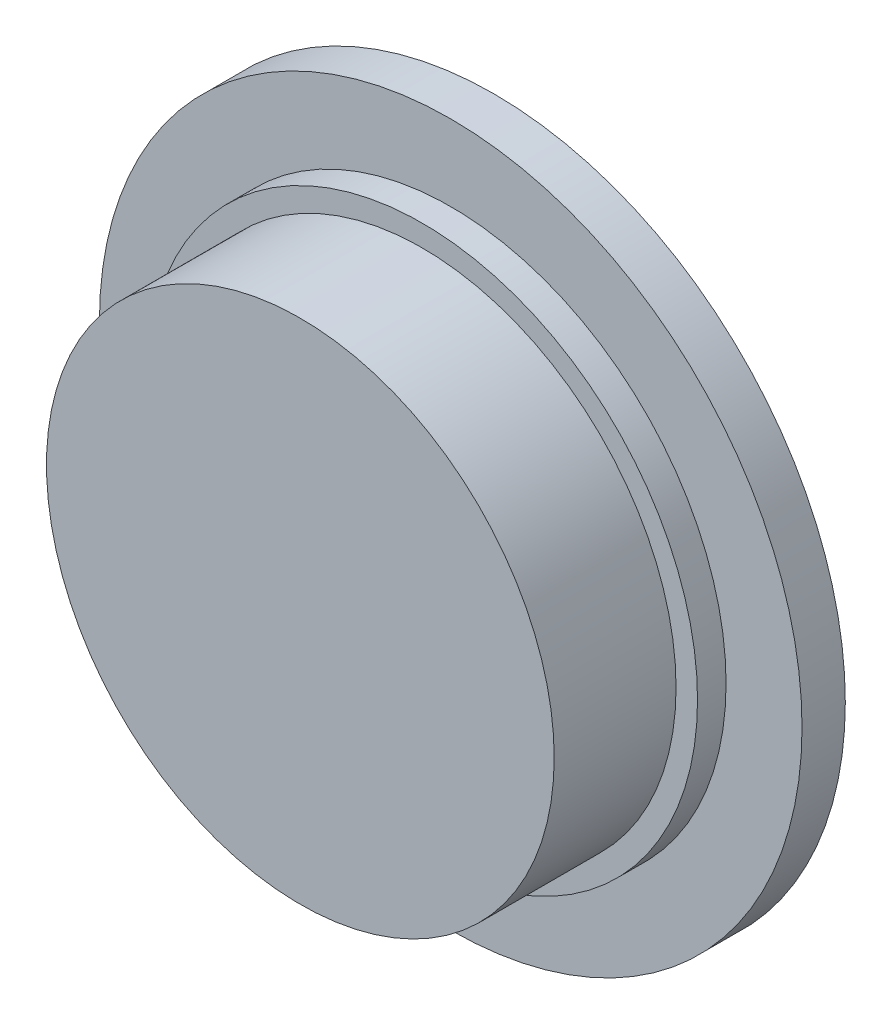
from build123d import *

# Parameters (mm, degrees)
SKETCH6_R          = 6.864817117
CUT_EXTRUDE2_DEPTH = 3.3
SKETCH5_R          = 15.702559167
CUT_EXTRUDE3_DEPTH = 40


with BuildPart() as part:
    # Sketch1 → Revolve2 (revolve)
    with BuildSketch(Plane(origin=(0, 0, 0), x_dir=(0, 0, -1), z_dir=(1, 0, 0))):
        with BuildLine():
            Line((1.771e-06, 9.5), (1.771e-06, 7.445611339))
            Line((1.771e-06, 7.445611339), (-0.771464581, 7.445611339))
            Line((-0.771464581, 7.445611339), (-0.771464581, 6.864817117))
            Line((-0.771464581, 6.864817117), (-4.066354879, 6.864817117))
            Line((-4.066354879, 6.864817117), (-4.066354879, 8.484339467))
            Line((-4.066354879, 8.484339467), (-4.975618005, 9.546154997))
            Line((-4.975618005, 9.546154997), (-7.06424338, 9.546154997))
            Line((-7.06424338, 9.546154997), (-7.767897919, 10.954193429))
            Line((-7.767897919, 10.954193429), (-9.164037876, 10.954193429))
            Line((-9.164037876, 10.954193429), (-9.945876251, 9.546154997))
            Line((-9.945876251, 9.546154997), (-9.945876251, 8))
            Line((-9.945876251, 8), (-19.896053439, 8))
            Line((-19.896053439, 8), (-20.566354879, 7.426001631))
            Line((-20.566354879, 7.426001631), (-23.121440557, 7.426001631))
            Line((-23.121440557, 7.426001631), (-23.682625072, 6.864817117))
            Line((-23.682625072, 6.864817117), (-23.682625072, 6.383537324))
            Line((-23.682625072, 6.383537324), (-27.0133813, 6.383537324))
            Line((-27.0133813, 6.383537324), (-27.0133813, 5.464238658))
            Line((-27.0133813, 5.464238658), (-31.931960755, 5.464238658))
            Line((-31.931960755, 5.464238658), (-31.931960755, 1.447456583))
            Line((-31.931960755, 1.447456583), (-38.111348046, 1.447456583))
            Line((-38.111348046, 1.447456583), (-38.931960755, 1.037362766))
            Line((-38.931960755, 1.037362766), (-38.931960755, 0))
            Line((-38.931960755, 0), (2.933645121, 0))
            ThreePointArc((2.933645121, 0), (2.489100327, 4.831124101), (1.170397182, 9.5))
            Line((1.170397182, 9.5), (1.771e-06, 9.5))
        make_face()
    revolve(axis=Axis((0, 0, 38.931960755), (0, 0, -1)))


with BuildPart() as body_2:
    # Split1: the piece on the far side of the plane
    add(part.part)
    split(bisect_by=Plane(origin=(0, 6.864817117, 4.066354879), x_dir=(1, 0, 0), z_dir=(0, 0, 1)), keep=Keep.BOTTOM)


with BuildPart() as part_1:
    add(part.part)

    # Split1
    split(bisect_by=Plane(origin=(0, 6.864817117, 4.066354879), x_dir=(1, 0, 0), z_dir=(0, 0, 1)), keep=Keep.TOP)

    # Sketch6 → Cut-Extrude2 (cut)
    with BuildSketch(Plane(origin=(0, 0, 4.066354879), x_dir=(-1, 0, 0), z_dir=(0, 0, -1))):
        Circle(SKETCH6_R)
    extrude(amount=-CUT_EXTRUDE2_DEPTH, mode=Mode.SUBTRACT)

    # Sketch5 → Cut-Extrude3 (cut)
    with BuildSketch(Plane(origin=(0, 0, 4.066354879), x_dir=(-1, 0, 0), z_dir=(0, 0, -1))):
        Circle(SKETCH5_R)
    extrude(amount=-CUT_EXTRUDE3_DEPTH, mode=Mode.SUBTRACT)


solid = body_2.part
